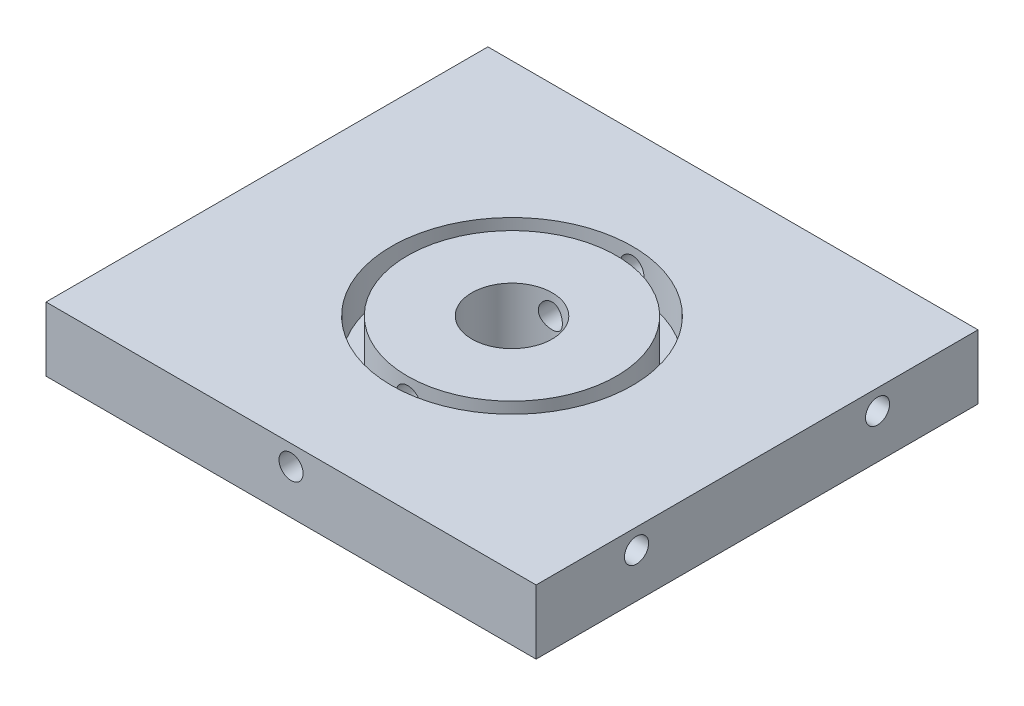
from build123d import *

# Parameters (mm, degrees)
ESQUISSE1_W             = 61
ESQUISSE1_H             = 8
BOSS_EXTRU_1_DEPTH      = 55
ESQUISSE2_R             = 15
ESQUISSE2_R_2           = 13
ENL_V_MAT_EXTRU_1_DEPTH = 5
ESQUISSE3_R             = 1.5
ENL_V_MAT_EXTRU_2_DEPTH = 10
ENL_V_START             = -10
ESQUISSE4_R             = 1.5
ENL_V_MAT_EXTRU_3_DEPTH = 10
ESQUISSE5_R             = 1.5
ENL_V_MAT_EXTRU_4_DEPTH = 95.415305963
ESQUISSE6_R             = 5
ENL_V_MAT_EXTRU_5_DEPTH = 79.544573403


with BuildPart() as part:
    # Esquisse1 → Boss.-Extru.1 (new body)
    with BuildSketch(Plane.XY):
        with Locations((25, -49)):
            Rectangle(ESQUISSE1_W, ESQUISSE1_H)
    extrude(amount=BOSS_EXTRU_1_DEPTH)

    # Esquisse2 → Enlèv. mat.-Extru.1 (cut)
    with BuildSketch(Plane(origin=(0, -45, 0), x_dir=(-1, 0, 0), z_dir=(0, 1, 0))):
        with Locations((-25, 27.5)):
            Circle(ESQUISSE2_R)
        with Locations((-25, 27.5)):
            Circle(ESQUISSE2_R_2, mode=Mode.SUBTRACT)
    extrude(amount=-ENL_V_MAT_EXTRU_1_DEPTH, mode=Mode.SUBTRACT)

    # Esquisse3 → Enlèv. mat.-Extru.2 (cut)
    with BuildSketch(Plane.ZY.offset(5.5)):
        with Locations((12.5, -47.5)):
            Circle(ESQUISSE3_R)
        with Locations((42.5, -47.5)):
            Circle(ESQUISSE3_R)
    extrude(amount=-ENL_V_MAT_EXTRU_2_DEPTH, mode=Mode.SUBTRACT)

    # Esquisse4 → Enlèv. mat.-Extru.3 (cut)
    with BuildSketch(Plane(origin=(55.5, 0, 0), x_dir=(0, 0, -1), z_dir=(1, 0, 0)).offset(ENL_V_START)):
        with Locations((-42.5, -47.5)):
            Circle(ESQUISSE4_R)
        with Locations((-12.5, -47.5)):
            Circle(ESQUISSE4_R)
    extrude(amount=ENL_V_MAT_EXTRU_3_DEPTH, mode=Mode.SUBTRACT)

    # Esquisse5 → Enlèv. mat.-Extru.4 (cut, through all)
    with BuildSketch(Plane(origin=(0, 0, 0), x_dir=(-1, 0, 0), z_dir=(0, 0, -1))):
        with Locations((-25, -47.5)):
            Circle(ESQUISSE5_R)
    extrude(amount=-ENL_V_MAT_EXTRU_4_DEPTH, mode=Mode.SUBTRACT)

    # Esquisse6 → Enlèv. mat.-Extru.5 (cut, through all)
    with BuildSketch(Plane(origin=(0, -45, 0), x_dir=(1, 0, 0), z_dir=(0, 1, 0))):
        with Locations((25, -27.5)):
            Circle(ESQUISSE6_R)
    extrude(amount=-ENL_V_MAT_EXTRU_5_DEPTH, mode=Mode.SUBTRACT)


solid = part.part
